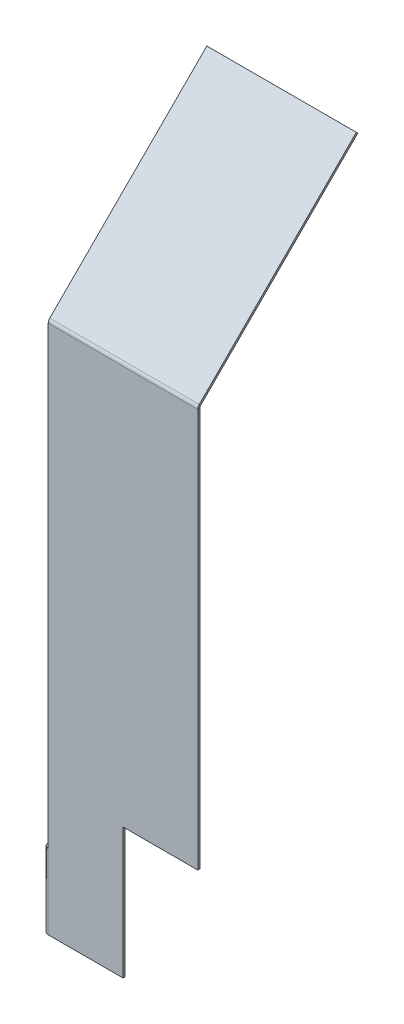
from build123d import *

# Parameters (mm, degrees)
SKETCH1_W          = 50.8
SKETCH1_H          = 180
BASE_FLANGE1_DEPTH = 0.7
EDGE_FLANGE1_DEPTH = 25.4
SKETCH9_W          = 25.4
SKETCH9_H          = 44.45
CUT_EXTRUDE1_DEPTH = 10
EDGE_FLANGE2_DEPTH = 50.8


# Sheet-metal steps are written as plain solids
with BuildPart() as part:
    # Sketch1 → Base-Flange1 (new body)
    with BuildSketch(Plane.XY):
        with Locations((0, -20.15)):
            Rectangle(SKETCH1_W, SKETCH1_H)
    extrude(amount=-BASE_FLANGE1_DEPTH)

    # Edge-Flange1 section (across the edge) → Edge-Flange1 (add)
    with BuildSketch(Plane(origin=(-26.4, -110.15, -0.7), x_dir=(1, 0, 0), z_dir=(0, 1, 0))):
        with BuildLine():
            Line((-0.7, 1), (-0.7, 24.7))
            Line((-0.7, 24.7), (0, 24.7))
            Line((0, 24.7), (0, 1))
            ThreePointArc((0, 1), (0.292893219, 0.292893219), (1, 0))
            Line((1, 0), (1, -0.7))
            ThreePointArc((1, -0.7), (-0.202081528, -0.202081528), (-0.7, 1))
        make_face()
    extrude(amount=EDGE_FLANGE1_DEPTH)

    # Sketch9 → Cut-Extrude1 (cut)
    with BuildSketch(Plane.XY):
        with Locations((12.7, -87.925)):
            Rectangle(SKETCH9_W, SKETCH9_H)
    extrude(amount=-CUT_EXTRUDE1_DEPTH, mode=Mode.SUBTRACT)

    # Edge-Flange2 section (across the edge) → Edge-Flange2 (add)
    with BuildSketch(Plane(origin=(-25.4, 70.264213562, -0.7), x_dir=(0, -0.7071067811865438, -0.7071067811865512), z_dir=(1, 0, 0))):
        with BuildLine():
            Line((-0.7, 0.414213562), (-0.7, 75.910050506))
            Line((-0.7, 75.910050506), (0, 75.910050506))
            Line((0, 75.910050506), (0, 0.414213562))
            ThreePointArc((0, 0.414213562), (0.076120467, 0.03153013), (0.292893219, -0.292893219))
            Line((0.292893219, -0.292893219), (-0.202081528, -0.787867966))
            ThreePointArc((-0.202081528, -0.787867966), (-0.570595205, -0.236348273), (-0.7, 0.414213562))
        make_face()
    extrude(amount=EDGE_FLANGE2_DEPTH)


solid = part.part
